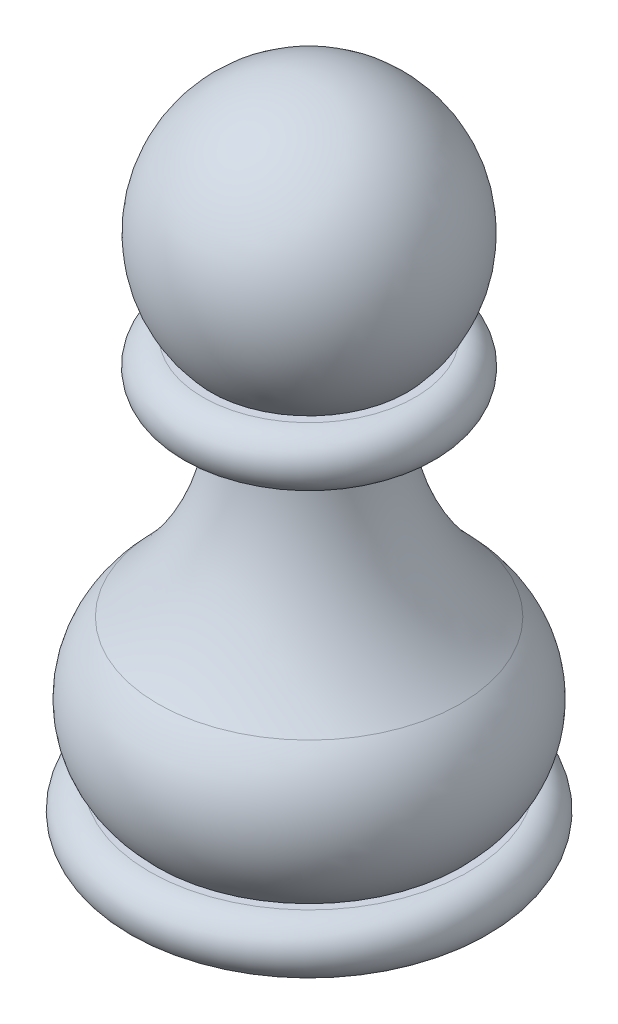
from build123d import *

# Parameters (mm, degrees)
SKETCH1_21_W   = 101.6
SKETCH1_21_H   = 273.621869484
SKETCH1_21_W_2 = 217.474407401
SKETCH1_21_H_2 = 76.2


with BuildPart() as part:
    # Sketch1<19> (on Front Plane) → Revolve15 (revolve)
    with BuildSketch(Plane.XY):
        with BuildLine():
            Line((-97.466524554, 425.838329959), (43.396058091, 425.838329959))
            Line((43.396058091, 425.838329959), (43.396058091, 744.588019278))
            ThreePointArc((43.396058091, 744.588019278), (-130.847759324, 631.090240625), (-97.466524554, 425.838329959))
        make_face()
    revolve(axis=Axis((43.396058091, 349.638329959, 0), (0, -1, 0)))

    # Sketch1<21> (on Front Plane) → Revolve16 (revolve)
    with BuildSketch(Plane.XY):
        with Locations((-7.403941909, 212.827395217)):
            Rectangle(SKETCH1_21_W, SKETCH1_21_H)
        with BuildLine():
            Line((-174.07834931, 76.015560166), (-174.93107388, -127.184439834))
            ThreePointArc((-174.93107388, -127.184439834), (-217.2793279, -25.404937047), (-174.07834931, 76.015560166))
        make_face()
        with BuildLine():
            ThreePointArc((-58.203941909, 349.638329959), (-88.366478986, 201.064864596), (-174.07834931, 76.015560166))
            Line((-174.07834931, 76.015560166), (-58.203941909, 76.015560166))
            Line((-58.203941909, 76.015560166), (-58.203941909, 76.016460475))
            Line((-58.203941909, 76.016460475), (-58.203941909, 349.638329959))
        make_face()
        with BuildLine():
            Line((-174.07834931, -203.384439834), (-174.07834931, -127.184439834))
            Line((-174.07834931, -127.184439834), (-174.93107388, -127.184439834))
            Line((-174.93107388, -127.184439834), (-185.98963186, -127.184439834))
            ThreePointArc((-185.98963186, -127.184439834), (-224.08963186, -165.284439834), (-185.98963186, -203.384439834))
            Line((-185.98963186, -203.384439834), (-174.07834931, -203.384439834))
        make_face()
        with Locations((-65.34114561, -165.284439834)):
            Rectangle(SKETCH1_21_W_2, SKETCH1_21_H_2)
        with BuildLine():
            Line((-109.414966969, 349.638329959), (-58.203941909, 349.638329959))
            Line((-58.203941909, 349.638329959), (43.396058091, 349.638329959))
            Line((43.396058091, 349.638329959), (43.396058091, 425.838329959))
            Line((43.396058091, 425.838329959), (-97.466524554, 425.838329959))
            Line((-97.466524554, 425.838329959), (-109.414966969, 425.838329959))
            ThreePointArc((-109.414966969, 425.838329959), (-82.474198606, 414.679098322), (-71.314966969, 387.738329959))
            ThreePointArc((-71.314966969, 387.738329959), (-82.474198606, 360.797561595), (-109.414966969, 349.638329959))
        make_face()
        with BuildLine():
            ThreePointArc((-109.414966969, 425.838329959), (-147.514966969, 387.738329959), (-109.414966969, 349.638329959))
            Line((-109.414966969, 349.638329959), (-109.414966969, 425.838329959))
        make_face()
        with BuildLine():
            Line((-109.414966969, 425.838329959), (-109.414966969, 349.638329959))
            ThreePointArc((-109.414966969, 349.638329959), (-82.474198606, 360.797561595), (-71.314966969, 387.738329959))
            ThreePointArc((-71.314966969, 387.738329959), (-82.474198606, 414.679098322), (-109.414966969, 425.838329959))
        make_face()
        with BuildLine():
            ThreePointArc((-109.414966969, 425.838329959), (-147.514966969, 387.738329959), (-109.414966969, 349.638329959))
            Line((-109.414966969, 349.638329959), (-109.414966969, 425.838329959))
        make_face()
        with BuildLine():
            Line((-109.414966969, 425.838329959), (-109.414966969, 349.638329959))
            ThreePointArc((-109.414966969, 349.638329959), (-82.474198606, 360.797561595), (-71.314966969, 387.738329959))
            ThreePointArc((-71.314966969, 387.738329959), (-82.474198606, 414.679098322), (-109.414966969, 425.838329959))
        make_face()
    revolve(axis=Axis((43.396058091, 744.588019278, 0), (0, -1, 0)))


solid = part.part
